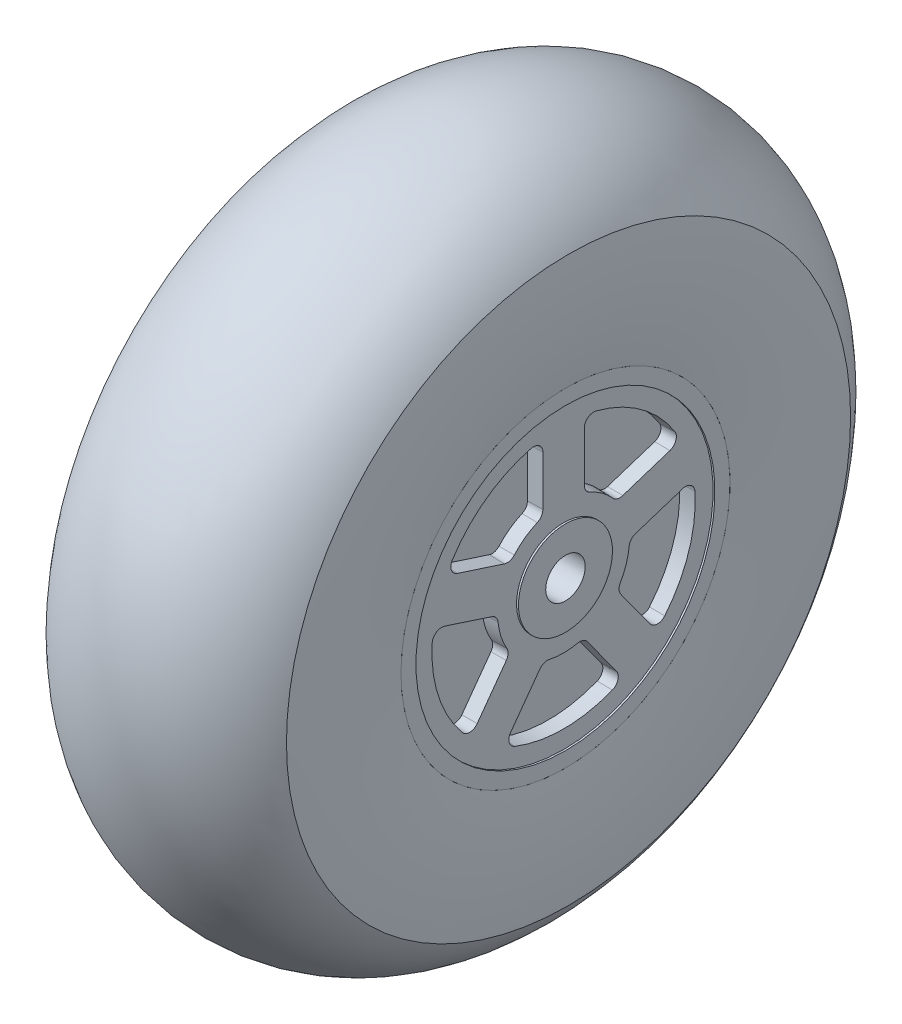
from build123d import *

# Parameters (mm, degrees)
EXTRUDE1_DEPTH       = 1.6
EXTRUDE1_TAPER       = 1.5000000000000033
CIRPATTERN1_COUNT    = 5
MIRROR1_COPY_1_DEPTH = 1.6
MIRROR1_COPY_1_TAPER = 1.5000000000000033
MIRROR1_COPY_2_DEPTH = 1.6
MIRROR1_COPY_2_TAPER = 1.5000000000000033
MIRROR1_COPY_3_DEPTH = 1.6
MIRROR1_COPY_3_TAPER = 1.5000000000000033
MIRROR1_COPY_4_DEPTH = 1.6
MIRROR1_COPY_4_TAPER = 1.5000000000000033
MIRROR1_COPY_5_DEPTH = 1.6
MIRROR1_COPY_5_TAPER = 1.5000000000000033


with BuildPart() as part:
    # Sketch1 → Revolve1 (revolve)
    with BuildSketch(Plane.XY):
        with BuildLine():
            Line((12.172675980385165, 17.5), (9, 14.489242912947049))
            Line((9, 14.489242912947049), (9.000000000000002, 6.999999999999997))
            Line((9.000000000000002, 6.999999999999997), (-9.000000000000002, 6.999999999999997))
            Line((-9.000000000000002, 6.999999999999997), (-9, 14.489242912947049))
            Line((-9, 14.489242912947049), (-12.172675980385165, 17.5))
            ThreePointArc((-12.172675980385165, 17.5), (-12.636235187685259, 23.742146915507664), (-12.5, 30))
            ThreePointArc((-12.5, 30), (-2.36e-15, 37), (12.5, 30))
            ThreePointArc((12.5, 30), (12.636235187685259, 23.74214691550764), (12.172675980385165, 17.5))
        make_face()
    revolve(axis=Axis((0, 0, 0), (1, 0, 0)))


with BuildPart() as body_2:
    # Sketch3 → Revolve2 (revolve)
    with BuildSketch(Plane.XY):
        Polygon((-9, 14.489242912947049), (-12.17267598038517, 17.500000000000014), (-12.17267598038517, 15.900000000000015), (-11.97267598038517, 15.900000000000015), (-11.972675980385167, 4.999999999999997), (-12.172675980385169, 4.999999999999998), (-12.17267598038517, 2.0999999999999996), (12.17267598038517, 2.0999999999999996), (12.172675980385169, 4.999999999999998), (11.972675980385167, 4.999999999999997), (11.97267598038517, 15.900000000000015), (12.17267598038517, 15.900000000000015), (12.17267598038517, 17.500000000000014), (9, 14.489242912947049), (9.000000000000002, 6.999999999999997), (-9.000000000000002, 6.999999999999997), align=None)
    revolve(axis=Axis((0, 0, 0), (-1, -1.2e-16, 0)))

    # Sketch2 → Extrude1 (cut)
    with BuildSketch(Plane(origin=(-11.972675980385166, -1.41e-15, 0), x_dir=(0, 0, -1), z_dir=(1, 1.2e-16, 0))):
        with BuildLine():
            Line((2.2, 12.600000000000001), (2.200000000000001, 7.332121111929343))
            ThreePointArc((2.200000000000001, 7.332121111929343), (2.3633399734659255, 6.784398554424177), (2.8000000000000007, 6.415605972938175))
            ThreePointArc((2.8000000000000007, 6.415605972938175), (4.114496766047321, 5.663118960624628), (5.236356282295121, 4.645489520477732))
            ThreePointArc((5.236356282295121, 4.645489520477732), (5.722034239041937, 4.344164331915463), (6.293424174140796, 4.358074364250823))
            Line((6.293424174140796, 4.358074364250823), (11.303474717694066, 5.985938464973643))
            ThreePointArc((11.303474717694066, 5.985938464973643), (11.934894376419996, 6.597026009884018), (11.840185240497515, 7.470609979827936))
            ThreePointArc((11.840185240497515, 7.470609979827936), (8.22899353209464, 11.32623792124925), (3.446153846153846, 13.569230769230767))
            ThreePointArc((3.446153846153846, 13.569230769230767), (2.58605938648508, 13.389352217376327), (2.2, 12.600000000000001))
        make_face()
    extrude1 = extrude(amount=EXTRUDE1_DEPTH, taper=EXTRUDE1_TAPER, mode=Mode.SUBTRACT)

    # CirPattern1: Extrude1 ×5 about axis
    cirpattern1_axis = Axis((0, 0, 0), (-1, 0, 0))
    for i in range(1, CIRPATTERN1_COUNT):
        add(extrude1.rotate(cirpattern1_axis, i * 360 / CIRPATTERN1_COUNT), mode=Mode.SUBTRACT)

    # Mirror1 copy 1 sketch → Mirror1 copy 1 (cut)
    with BuildSketch(Plane(origin=(11.972675980385166, -4.4e-16, 1.34e-15), x_dir=(0, -0.9510565162951535, -0.30901699437494745), z_dir=(-1, 4e-17, -1.1e-16))):
        with BuildLine():
            Line((2.2, -12.600000000000001), (2.200000000000001, -7.332121111929343))
            ThreePointArc((2.200000000000001, -7.332121111929343), (2.3633399734659255, -6.784398554424177), (2.8000000000000007, -6.415605972938175))
            ThreePointArc((2.8000000000000007, -6.415605972938175), (4.114496766047321, -5.663118960624628), (5.236356282295121, -4.645489520477732))
            ThreePointArc((5.236356282295121, -4.645489520477732), (5.722034239041937, -4.344164331915463), (6.293424174140796, -4.358074364250823))
            Line((6.293424174140796, -4.358074364250823), (11.303474717694066, -5.985938464973643))
            ThreePointArc((11.303474717694066, -5.985938464973643), (11.934894376419996, -6.597026009884018), (11.840185240497515, -7.470609979827936))
            ThreePointArc((11.840185240497515, -7.470609979827936), (8.22899353209464, -11.32623792124925), (3.446153846153846, -13.569230769230767))
            ThreePointArc((3.446153846153846, -13.569230769230767), (2.58605938648508, -13.389352217376327), (2.2, -12.600000000000001))
        make_face()
    extrude(amount=MIRROR1_COPY_1_DEPTH, taper=MIRROR1_COPY_1_TAPER, mode=Mode.SUBTRACT)

    # Mirror1 copy 2 sketch → Mirror1 copy 2 (cut)
    with BuildSketch(Plane(origin=(11.972675980385166, 1.14e-15, 8.3e-16), x_dir=(0, -0.5877852522924732, 0.8090169943749473), z_dir=(-1, -1e-16, -7e-17))):
        with BuildLine():
            Line((2.2, -12.600000000000001), (2.200000000000001, -7.332121111929343))
            ThreePointArc((2.200000000000001, -7.332121111929343), (2.3633399734659255, -6.784398554424177), (2.8000000000000007, -6.415605972938175))
            ThreePointArc((2.8000000000000007, -6.415605972938175), (4.114496766047321, -5.663118960624628), (5.236356282295121, -4.645489520477732))
            ThreePointArc((5.236356282295121, -4.645489520477732), (5.722034239041937, -4.344164331915463), (6.293424174140796, -4.358074364250823))
            Line((6.293424174140796, -4.358074364250823), (11.303474717694066, -5.985938464973643))
            ThreePointArc((11.303474717694066, -5.985938464973643), (11.934894376419996, -6.597026009884018), (11.840185240497515, -7.470609979827936))
            ThreePointArc((11.840185240497515, -7.470609979827936), (8.22899353209464, -11.32623792124925), (3.446153846153846, -13.569230769230767))
            ThreePointArc((3.446153846153846, -13.569230769230767), (2.58605938648508, -13.389352217376327), (2.2, -12.600000000000001))
        make_face()
    extrude(amount=MIRROR1_COPY_2_DEPTH, taper=MIRROR1_COPY_2_TAPER, mode=Mode.SUBTRACT)

    # Mirror1 copy 3 sketch → Mirror1 copy 3 (cut)
    with BuildSketch(Plane(origin=(11.972675980385164, 1.14e-15, -8.3e-16), x_dir=(0, 0.587785252292473, 0.8090169943749476), z_dir=(-0.9999999999999999, -1e-16, 7e-17))):
        with BuildLine():
            Line((2.2, -12.600000000000001), (2.200000000000001, -7.332121111929343))
            ThreePointArc((2.200000000000001, -7.332121111929343), (2.3633399734659255, -6.784398554424177), (2.8000000000000007, -6.415605972938175))
            ThreePointArc((2.8000000000000007, -6.415605972938175), (4.114496766047321, -5.663118960624628), (5.236356282295121, -4.645489520477732))
            ThreePointArc((5.236356282295121, -4.645489520477732), (5.722034239041937, -4.344164331915463), (6.293424174140796, -4.358074364250823))
            Line((6.293424174140796, -4.358074364250823), (11.303474717694066, -5.985938464973643))
            ThreePointArc((11.303474717694066, -5.985938464973643), (11.934894376419996, -6.597026009884018), (11.840185240497515, -7.470609979827936))
            ThreePointArc((11.840185240497515, -7.470609979827936), (8.22899353209464, -11.32623792124925), (3.446153846153846, -13.569230769230767))
            ThreePointArc((3.446153846153846, -13.569230769230767), (2.58605938648508, -13.389352217376327), (2.2, -12.600000000000001))
        make_face()
    extrude(amount=MIRROR1_COPY_3_DEPTH, taper=MIRROR1_COPY_3_TAPER, mode=Mode.SUBTRACT)

    # Mirror1 copy 4 sketch → Mirror1 copy 4 (cut)
    with BuildSketch(Plane(origin=(11.972675980385166, -4.4e-16, -1.34e-15), x_dir=(0, 0.9510565162951536, -0.30901699437494723), z_dir=(-1, 4e-17, 1.1e-16))):
        with BuildLine():
            Line((2.2, -12.600000000000001), (2.200000000000001, -7.332121111929343))
            ThreePointArc((2.200000000000001, -7.332121111929343), (2.3633399734659255, -6.784398554424177), (2.8000000000000007, -6.415605972938175))
            ThreePointArc((2.8000000000000007, -6.415605972938175), (4.114496766047321, -5.663118960624628), (5.236356282295121, -4.645489520477732))
            ThreePointArc((5.236356282295121, -4.645489520477732), (5.722034239041937, -4.344164331915463), (6.293424174140796, -4.358074364250823))
            Line((6.293424174140796, -4.358074364250823), (11.303474717694066, -5.985938464973643))
            ThreePointArc((11.303474717694066, -5.985938464973643), (11.934894376419996, -6.597026009884018), (11.840185240497515, -7.470609979827936))
            ThreePointArc((11.840185240497515, -7.470609979827936), (8.22899353209464, -11.32623792124925), (3.446153846153846, -13.569230769230767))
            ThreePointArc((3.446153846153846, -13.569230769230767), (2.58605938648508, -13.389352217376327), (2.2, -12.600000000000001))
        make_face()
    extrude(amount=MIRROR1_COPY_4_DEPTH, taper=MIRROR1_COPY_4_TAPER, mode=Mode.SUBTRACT)

    # Mirror1 copy 5 sketch → Mirror1 copy 5 (cut)
    with BuildSketch(Plane(origin=(11.972675980385166, -1.41e-15, 0), x_dir=(0, 0, -1), z_dir=(-1, 1.2e-16, 0))):
        with BuildLine():
            Line((2.2, -12.600000000000001), (2.200000000000001, -7.332121111929343))
            ThreePointArc((2.200000000000001, -7.332121111929343), (2.3633399734659255, -6.784398554424177), (2.8000000000000007, -6.415605972938175))
            ThreePointArc((2.8000000000000007, -6.415605972938175), (4.114496766047321, -5.663118960624628), (5.236356282295121, -4.645489520477732))
            ThreePointArc((5.236356282295121, -4.645489520477732), (5.722034239041937, -4.344164331915463), (6.293424174140796, -4.358074364250823))
            Line((6.293424174140796, -4.358074364250823), (11.303474717694066, -5.985938464973643))
            ThreePointArc((11.303474717694066, -5.985938464973643), (11.934894376419996, -6.597026009884018), (11.840185240497515, -7.470609979827936))
            ThreePointArc((11.840185240497515, -7.470609979827936), (8.22899353209464, -11.32623792124925), (3.446153846153846, -13.569230769230767))
            ThreePointArc((3.446153846153846, -13.569230769230767), (2.58605938648508, -13.389352217376327), (2.2, -12.600000000000001))
        make_face()
    extrude(amount=MIRROR1_COPY_5_DEPTH, taper=MIRROR1_COPY_5_TAPER, mode=Mode.SUBTRACT)


solid = Compound([part.part, body_2.part])
